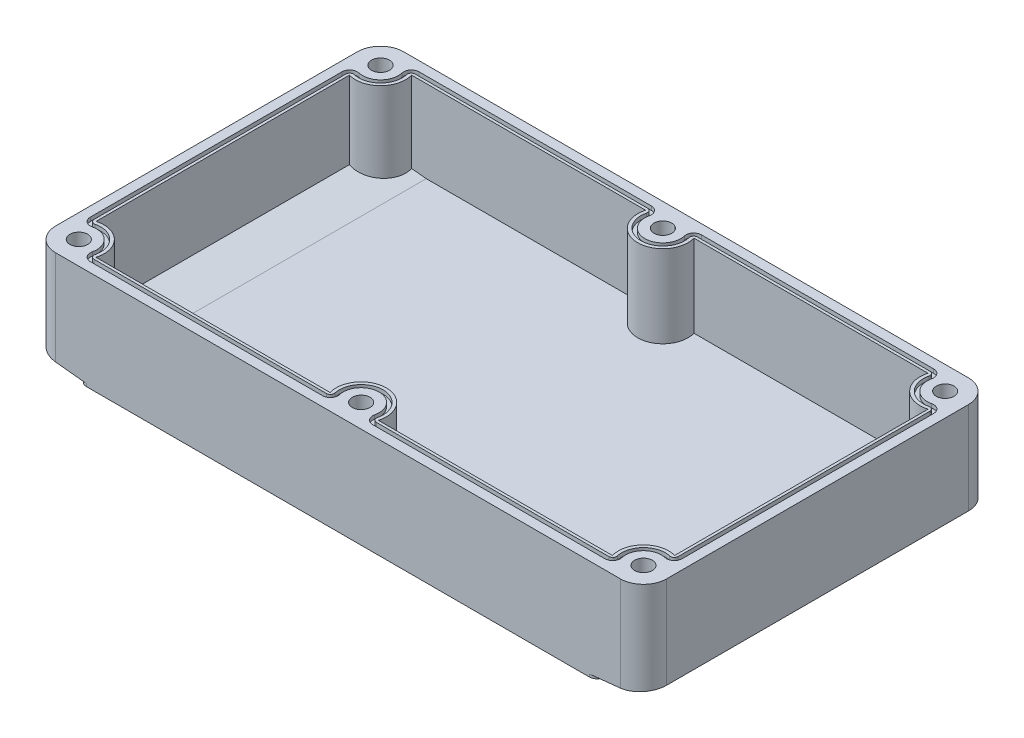
from build123d import *
from build123d.topology import SkipClean

# Parameters (mm, degrees)
SKETCH1_W               = 158
SKETCH1_H               = 90
BOSS_EXTRUDE1_DEPTH     = 26
FILLET1_R               = 6
SKETCH3_W               = 12
SKETCH3_H               = 90
CUT_EXTRUDE1_DEPTH      = 0.9
FILLET2_R               = 2
DRAFT1_ANGLE            = 6
DRAFT2_ANGLE            = 6
HOLE1_D                 = 4.6
HOLE1_DEPTH             = 26
HOLE1_TIP               = 1.381979424
CUT_EXTRUDE2_DEPTH      = 0.5
SHELL1_START            = -77.5
SHELL1_DEPTH            = 65
SHELL1_START_2          = -85.8
SHELL1_2_DEPTH          = 81.6
SHELL1_START_3          = 4.7
SHELL1_3_DEPTH          = 21.3
CUT_EXTRUDE_THIN1_DEPTH = 1


with BuildPart() as part:
    # Sketch1 → Boss-Extrude1 (new body)
    with BuildSketch(Plane(origin=(0, 0, 0), x_dir=(1, 0, 0), z_dir=(0, 1, 0))):
        with Locations((79, 45)):
            Rectangle(SKETCH1_W, SKETCH1_H)
    extrude(amount=BOSS_EXTRUDE1_DEPTH)

    # Fillet1
    fillet1_edges = [part.edges().sort_by_distance(p)[0] for p in [
        (0, 13, -90),
        (158, 13, -90),
        (158, 13, 0),
        (0, 13, 0),
    ]]
    fillet(fillet1_edges, radius=FILLET1_R)

    # Sketch3 → Cut-Extrude1 (cut)
    with BuildSketch(Plane.XZ):
        with Locations((6, -45)):
            Rectangle(SKETCH3_W, SKETCH3_H)
        with Locations((152, -45)):
            Rectangle(SKETCH3_W, SKETCH3_H)
    extrude(amount=-CUT_EXTRUDE1_DEPTH, mode=Mode.SUBTRACT)

    # Fillet2
    fillet2_edges = [part.edges().sort_by_distance(p)[0] for p in [
        (12, 0.45, -90),
        (12, 0.45, 0),
        (146, 0.45, 0),
        (146, 0.45, -90),
    ]]
    fillet(fillet2_edges, radius=FILLET2_R)

    # Draft1
    draft1_faces = [part.faces().sort_by_distance(p)[0] for p in [
        (151.922094589, 0.9, -45),
    ]]
    draft(draft1_faces, Plane(origin=(146, 0.9, 0), x_dir=(0, 0, 1), z_dir=(1, 0, 0)), DRAFT1_ANGLE)

    # Draft2
    draft2_faces = [part.faces().sort_by_distance(p)[0] for p in [
        (6.077905411, 0.9, -45),
    ]]
    draft(draft2_faces, Plane(origin=(12, 0.9, 0), x_dir=(0, 0, -1), z_dir=(-1, 0, 0)), DRAFT2_ANGLE)

    # Hole1
    with Locations(Plane(origin=(0, 0, 0), x_dir=(-1, 0, 0), z_dir=(0, -1, 0))):
        with Locations((-79, 6), (-79, 84), (-152, 6), (-152, 84), (-6, 84), (-6, 6)):
            Hole(HOLE1_D / 2, depth=HOLE1_DEPTH)
            with Locations((0, 0, -(HOLE1_DEPTH + HOLE1_TIP / 2))):  # 118° drill point
                Cone(0, HOLE1_D / 2, HOLE1_TIP, mode=Mode.SUBTRACT)

    # Sketch6 → Cut-Extrude2 (cut)
    with BuildSketch(Plane.XZ):
        with BuildLine():
            Line((72, -6), (72, -3))
            ThreePointArc((72, -3), (71.707106781, -2.292893219), (71, -2))
            Line((71, -2), (15, -2))
            ThreePointArc((15, -2), (14.292893219, -2.292893219), (14, -3))
            Line((14, -3), (14, -87))
            ThreePointArc((14, -87), (14.292893219, -87.707106781), (15, -88))
            Line((15, -88), (71, -88))
            ThreePointArc((71, -88), (71.707106781, -87.707106781), (72, -87))
            Line((72, -87), (72, -84))
            ThreePointArc((72, -84), (79, -77), (86, -84))
            Line((86, -84), (86, -87))
            ThreePointArc((86, -87), (86.292893219, -87.707106781), (87, -88))
            Line((87, -88), (143, -88))
            ThreePointArc((143, -88), (143.707106781, -87.707106781), (144, -87))
            Line((144, -87), (144, -3))
            ThreePointArc((144, -3), (143.707106781, -2.292893219), (143, -2))
            Line((143, -2), (87, -2))
            ThreePointArc((87, -2), (86.292893219, -2.292893219), (86, -3))
            Line((86, -3), (86, -6))
            ThreePointArc((86, -6), (79, -13), (72, -6))
        make_face()
    extrude(amount=-CUT_EXTRUDE2_DEPTH, mode=Mode.SUBTRACT)

    # Shell1: read off the stored shape, not the designer's step
    # Shell1 outline → Shell1 (cut)
    with BuildSketch(Plane.XY.offset(SHELL1_START)):
        Polygon((4.2, 5.942947809), (16.025858455, 4.7), (141.974141545, 4.7), (153.8, 5.942947809), (153.8, 26), (4.2, 26), align=None)
    extrude(amount=SHELL1_DEPTH, mode=Mode.SUBTRACT)

    # Shell1 2 outline → Shell1 2 (cut)
    with BuildSketch(Plane.XY.offset(SHELL1_START_2)):
        Polygon((4.2, 5.942947809), (16.025858455, 4.7), (141.974141545, 4.7), (153.8, 5.942947809), (153.8, 26), (4.2, 26), align=None)
    extrude(amount=SHELL1_2_DEPTH, mode=Mode.SUBTRACT)

    # Shell1 3 outline → Shell1 3 (add)
    with SkipClean():  # the faces are left unmerged after this step: merging them gives an invalid solid
        with BuildSketch(Plane(origin=(0, 0, 0), x_dir=(1, 0, 0), z_dir=(0, 1, 0)).offset(SHELL1_START_3)):
            with BuildLine():
                ThreePointArc((4.2, 7.431782106), (7.626345597, 7.626345597), (7.431782106, 4.2))
                Line((7.431782106, 4.2), (12.245798588, 4.2))
                ThreePointArc((12.245798588, 4.2), (10.596194078, 10.596194078), (4.2, 12.245798588))
                Line((4.2, 12.245798588), (4.2, 7.431782106))
            make_face()
            with BuildLine():
                ThreePointArc((4.568217894, 4.2), (4.373654403, 4.373654403), (4.2, 4.568217894))
                Line((4.2, 4.568217894), (4.2, 4.2))
                Line((4.2, 4.2), (4.568217894, 4.2))
            make_face()
            with BuildLine():
                Line((4.2, 82.568217894), (4.2, 77.754201412))
                ThreePointArc((4.2, 77.754201412), (10.596194078, 79.403805922), (12.245798588, 85.8))
                Line((12.245798588, 85.8), (7.431782106, 85.8))
                ThreePointArc((7.431782106, 85.8), (7.626345597, 82.373654403), (4.2, 82.568217894))
            make_face()
            with BuildLine():
                ThreePointArc((85.245798588, 4.2), (79, 12.5), (72.754201412, 4.2))
                Line((72.754201412, 4.2), (77.568217894, 4.2))
                ThreePointArc((77.568217894, 4.2), (79, 8.3), (80.431782106, 4.2))
                Line((80.431782106, 4.2), (85.245798588, 4.2))
            make_face()
            with BuildLine():
                Line((77.568217894, 85.8), (72.754201412, 85.8))
                ThreePointArc((72.754201412, 85.8), (79, 77.5), (85.245798588, 85.8))
                Line((85.245798588, 85.8), (80.431782106, 85.8))
                ThreePointArc((80.431782106, 85.8), (79, 81.7), (77.568217894, 85.8))
            make_face()
            with BuildLine():
                Line((4.2, 85.8), (4.2, 85.431782106))
                ThreePointArc((4.2, 85.431782106), (4.373654403, 85.626345597), (4.568217894, 85.8))
                Line((4.568217894, 85.8), (4.2, 85.8))
            make_face()
            with BuildLine():
                ThreePointArc((153.8, 12.245798588), (147.403805922, 10.596194078), (145.754201412, 4.2))
                Line((145.754201412, 4.2), (150.568217894, 4.2))
                ThreePointArc((150.568217894, 4.2), (150.373654403, 7.626345597), (153.8, 7.431782106))
                Line((153.8, 7.431782106), (153.8, 12.245798588))
            make_face()
            with BuildLine():
                Line((150.568217894, 85.8), (145.754201412, 85.8))
                ThreePointArc((145.754201412, 85.8), (147.403805922, 79.403805922), (153.8, 77.754201412))
                Line((153.8, 77.754201412), (153.8, 82.568217894))
                ThreePointArc((153.8, 82.568217894), (150.373654403, 82.373654403), (150.568217894, 85.8))
            make_face()
            with BuildLine():
                ThreePointArc((153.8, 4.568217894), (153.626345597, 4.373654403), (153.431782106, 4.2))
                Line((153.431782106, 4.2), (153.8, 4.2))
                Line((153.8, 4.2), (153.8, 4.568217894))
            make_face()
            with BuildLine():
                Line((153.8, 85.8), (153.431782106, 85.8))
                ThreePointArc((153.431782106, 85.8), (153.626345597, 85.626345597), (153.8, 85.431782106))
                Line((153.8, 85.431782106), (153.8, 85.8))
            make_face()
        extrude(amount=SHELL1_3_DEPTH)

    # Sketch7 → Cut-Extrude-Thin1 (cut)
    with SkipClean():  # the faces are left unmerged after this step: merging them gives an invalid solid
        with BuildSketch(Plane(origin=(0, 26, 0), x_dir=(1, 0, 0), z_dir=(0, 1, 0))):
            with BuildLine():
                ThreePointArc((10.530161934, 85.04887218), (9.288046533, 80.711953467), (4.95112782, 79.469838066))
                ThreePointArc((4.95112782, 79.469838066), (3.255463066, 79.086989132), (2.5, 77.52138132))
                Line((2.5, 77.52138132), (2.5, 12.47861868))
                ThreePointArc((2.5, 12.47861868), (3.255463066, 10.913010868), (4.95112782, 10.530161934))
                ThreePointArc((4.95112782, 10.530161934), (9.288046533, 9.288046533), (10.530161934, 4.95112782))
                ThreePointArc((10.530161934, 4.95112782), (10.913010868, 3.255463066), (12.47861868, 2.5))
                Line((12.47861868, 2.5), (72.52138132, 2.5))
                ThreePointArc((72.52138132, 2.5), (74.086989132, 3.255463066), (74.469838066, 4.95112782))
                ThreePointArc((74.469838066, 4.95112782), (79, 10.65), (83.530161934, 4.95112782))
                ThreePointArc((83.530161934, 4.95112782), (83.913010868, 3.255463066), (85.47861868, 2.5))
                Line((85.47861868, 2.5), (145.52138132, 2.5))
                ThreePointArc((145.52138132, 2.5), (147.086989132, 3.255463066), (147.469838066, 4.95112782))
                ThreePointArc((147.469838066, 4.95112782), (148.711953467, 9.288046533), (153.04887218, 10.530161934))
                ThreePointArc((153.04887218, 10.530161934), (154.744536934, 10.913010868), (155.5, 12.47861868))
                Line((155.5, 12.47861868), (155.5, 77.52138132))
                ThreePointArc((155.5, 77.52138132), (154.744536934, 79.086989132), (153.04887218, 79.469838066))
                ThreePointArc((153.04887218, 79.469838066), (148.711953467, 80.711953467), (147.469838066, 85.04887218))
                ThreePointArc((147.469838066, 85.04887218), (147.086989132, 86.744536934), (145.52138132, 87.5))
                Line((145.52138132, 87.5), (85.47861868, 87.5))
                ThreePointArc((85.47861868, 87.5), (83.913010868, 86.744536934), (83.530161934, 85.04887218))
                ThreePointArc((83.530161934, 85.04887218), (79, 79.35), (74.469838066, 85.04887218))
                ThreePointArc((74.469838066, 85.04887218), (74.086989132, 86.744536934), (72.52138132, 87.5))
                Line((72.52138132, 87.5), (12.47861868, 87.5))
                ThreePointArc((12.47861868, 87.5), (10.913010868, 86.744536934), (10.530161934, 85.04887218))
            make_face()
            with BuildLine():
                ThreePointArc((11.504390307, 85.27443609), (9.995153314, 80.004846686), (4.72556391, 78.495609693))
                ThreePointArc((4.72556391, 78.495609693), (3.877731533, 78.304185226), (3.5, 77.52138132))
                Line((3.5, 77.52138132), (3.5, 12.47861868))
                ThreePointArc((3.5, 12.47861868), (3.877731533, 11.695814774), (4.72556391, 11.504390307))
                ThreePointArc((4.72556391, 11.504390307), (9.995153314, 9.995153314), (11.504390307, 4.72556391))
                ThreePointArc((11.504390307, 4.72556391), (11.695814774, 3.877731533), (12.47861868, 3.5))
                Line((12.47861868, 3.5), (72.52138132, 3.5))
                ThreePointArc((72.52138132, 3.5), (73.304185226, 3.877731533), (73.495609693, 4.72556391))
                ThreePointArc((73.495609693, 4.72556391), (79, 11.65), (84.504390307, 4.72556391))
                ThreePointArc((84.504390307, 4.72556391), (84.695814774, 3.877731533), (85.47861868, 3.5))
                Line((85.47861868, 3.5), (145.52138132, 3.5))
                ThreePointArc((145.52138132, 3.5), (146.304185226, 3.877731533), (146.495609693, 4.72556391))
                ThreePointArc((146.495609693, 4.72556391), (148.004846686, 9.995153314), (153.27443609, 11.504390307))
                ThreePointArc((153.27443609, 11.504390307), (154.122268467, 11.695814774), (154.5, 12.47861868))
                Line((154.5, 12.47861868), (154.5, 77.52138132))
                ThreePointArc((154.5, 77.52138132), (154.122268467, 78.304185226), (153.27443609, 78.495609693))
                ThreePointArc((153.27443609, 78.495609693), (148.004846686, 80.004846686), (146.495609693, 85.27443609))
                ThreePointArc((146.495609693, 85.27443609), (146.304185226, 86.122268467), (145.52138132, 86.5))
                Line((145.52138132, 86.5), (85.47861868, 86.5))
                ThreePointArc((85.47861868, 86.5), (84.695814774, 86.122268467), (84.504390307, 85.27443609))
                ThreePointArc((84.504390307, 85.27443609), (79, 78.35), (73.495609693, 85.27443609))
                ThreePointArc((73.495609693, 85.27443609), (73.304185226, 86.122268467), (72.52138132, 86.5))
                Line((72.52138132, 86.5), (12.47861868, 86.5))
                ThreePointArc((12.47861868, 86.5), (11.695814774, 86.122268467), (11.504390307, 85.27443609))
            make_face(mode=Mode.SUBTRACT)
        extrude(amount=-CUT_EXTRUDE_THIN1_DEPTH, mode=Mode.SUBTRACT)


solid = part.part
